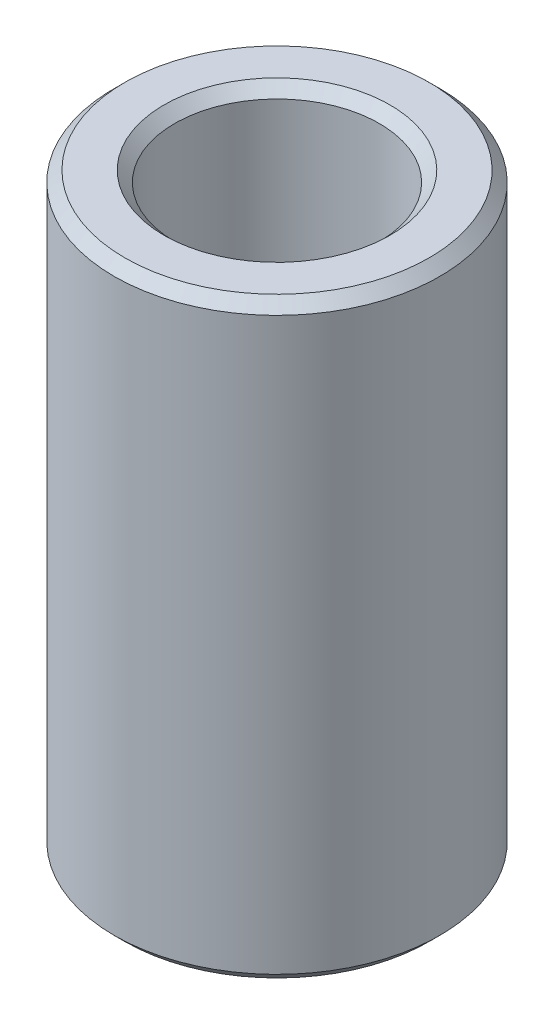
from build123d import *

# Parameters (mm, degrees)
SKETCH1_R           = 35
BOSS_EXTRUDE1_DEPTH = 127.300378566
SKETCH2_R           = 21.992426548
CUT_EXTRUDE1_DEPTH  = 137.584722364
CHAMFER1_SIZE       = 2.302334025


with BuildPart() as part:
    # Sketch1 → Boss-Extrude1 (new body)
    with BuildSketch(Plane(origin=(0, 0, 0), x_dir=(1, 0, 0), z_dir=(0, 1, 0))):
        Circle(SKETCH1_R)
    extrude(amount=BOSS_EXTRUDE1_DEPTH)

    # Sketch2 → Cut-Extrude1 (cut, through all)
    with BuildSketch(Plane(origin=(0, 0, 0), x_dir=(1, 0, 0), z_dir=(0, 1, 0))):
        Circle(SKETCH2_R)
    extrude(amount=CUT_EXTRUDE1_DEPTH, mode=Mode.SUBTRACT)

    # Chamfer1
    chamfer1_edges = [part.edges().sort_by_distance(p)[0] for p in [
        (-21.992426548, 127.300378566, 0),
        (-21.992426548, 0, 0),
        (-35, 0, 0),
        (-35, 127.300378566, 0),
    ]]
    chamfer(chamfer1_edges, length=CHAMFER1_SIZE)


solid = part.part
